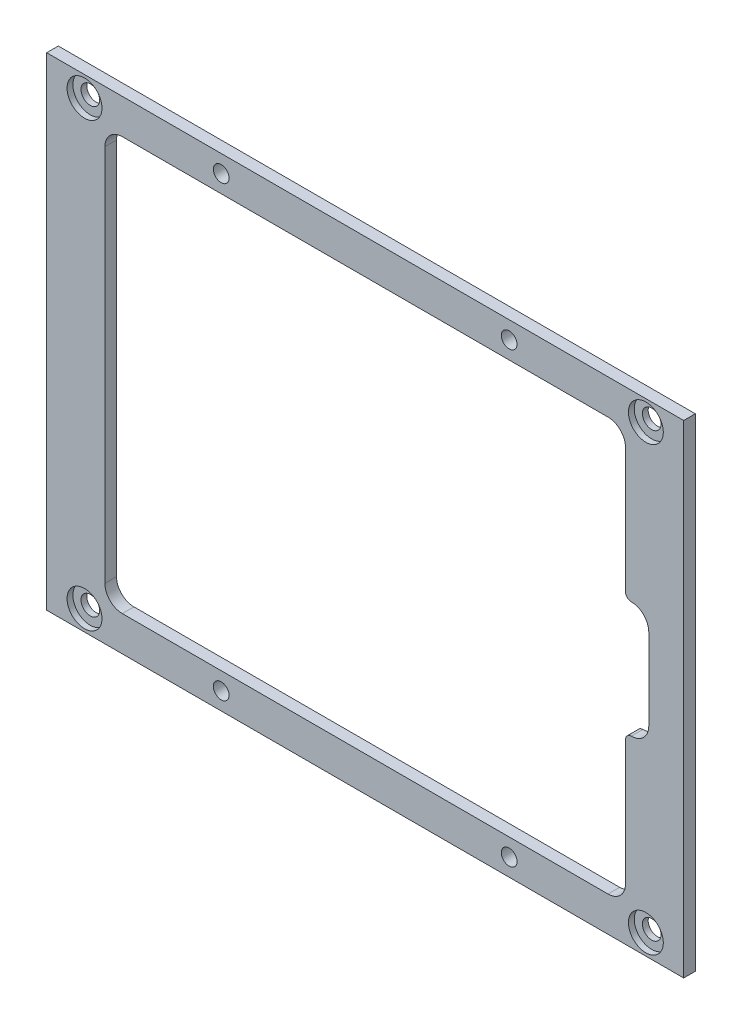
from build123d import *

# Parameters (mm, degrees)
SKETCH1_W                  = 109.5
SKETCH1_H                  = 83
BOSS_EXTRUDE1_DEPTH        = 2
F_3_2_3_2_DIAMETER_HOLE1_D = 3.2
F_2_7_2_7_DIAMETER_HOLE1_D = 2.7
SKETCH12_R                 = 3
CUT_EXTRUDE1_DEPTH         = 1
FILLET1_R                  = 3
FILLET2_R                  = 1


with BuildPart() as part:
    # Sketch1 → Boss-Extrude1 (new body)
    with BuildSketch(Plane.XY.offset(7.43465612)):
        with Locations((-0.743641502, 44.95185693)):
            Rectangle(SKETCH1_W, SKETCH1_H)
        with BuildLine():
            Line((-42.493641502, 80.45185693), (41.006358498, 80.45185693))
            ThreePointArc((41.006358498, 80.45185693), (43.127678842, 79.573177274), (44.006358498, 77.45185693))
            Line((44.006358498, 77.45185693), (44.006358498, 54.95185693))
            Line((44.006358498, 54.95185693), (48.006358498, 54.95185693))
            Line((48.006358498, 54.95185693), (48.006358498, 44.95185693))
            Line((48.006358498, 44.95185693), (48.006358498, 34.95185693))
            Line((48.006358498, 34.95185693), (44.006358498, 34.95185693))
            Line((44.006358498, 34.95185693), (44.006358498, 12.45185693))
            ThreePointArc((44.006358498, 12.45185693), (43.127678842, 10.330536587), (41.006358498, 9.45185693))
            Line((41.006358498, 9.45185693), (-42.493641502, 9.45185693))
            ThreePointArc((-42.493641502, 9.45185693), (-44.614961845, 10.330536587), (-45.493641502, 12.45185693))
            Line((-45.493641502, 12.45185693), (-45.493641502, 77.45185693))
            ThreePointArc((-45.493641502, 77.45185693), (-44.614961845, 79.573177274), (-42.493641502, 80.45185693))
        make_face(mode=Mode.SUBTRACT)
    extrude(amount=BOSS_EXTRUDE1_DEPTH)

    # Ø3.2 (3.2) Diameter Hole1 (through all)
    with Locations(Plane.XY.offset(9.43465612)):
        with Locations((-48.993641502, 6.95185693), (-48.993641502, 82.95185693), (47.506358498, 82.95185693), (47.506358498, 6.95185693)):
            Hole(F_3_2_3_2_DIAMETER_HOLE1_D / 2)

    # Ø2.7 (2.7) Diameter Hole1 (through all)
    with Locations(Plane(origin=(-25.493641502, 83.45185693, 9.43465612), x_dir=(1, 0, 0), z_dir=(0, 0, 1))):
        with Locations((0, 0), (49.5, 0), (49.5, -77), (0, -77)):
            Hole(F_2_7_2_7_DIAMETER_HOLE1_D / 2)

    # Sketch12 → Cut-Extrude1 (cut)
    with BuildSketch(Plane.XY.offset(9.43465612)):
        with Locations((-48.993641502, 82.95185693)):
            Circle(SKETCH12_R)
        with Locations((47.506358498, 82.95185693)):
            Circle(SKETCH12_R)
        with Locations((47.506358498, 6.95185693)):
            Circle(SKETCH12_R)
        with Locations((-48.993641502, 6.95185693)):
            Circle(SKETCH12_R)
    extrude(amount=-CUT_EXTRUDE1_DEPTH, mode=Mode.SUBTRACT)

    # Fillet1
    fillet1_edges = [part.edges().sort_by_distance(p)[0] for p in [
        (48.006358498, 34.95185693, 8.43465612),
        (48.006358498, 54.95185693, 8.43465612),
    ]]
    fillet(fillet1_edges, radius=FILLET1_R)

    # Fillet2
    fillet2_edges = [part.edges().sort_by_distance(p)[0] for p in [
        (44.006358498, 34.95185693, 8.43465612),
        (44.006358498, 54.95185693, 8.43465612),
    ]]
    fillet(fillet2_edges, radius=FILLET2_R - 0.0001)  # a hair under: the kernel refuses the full size


solid = part.part
